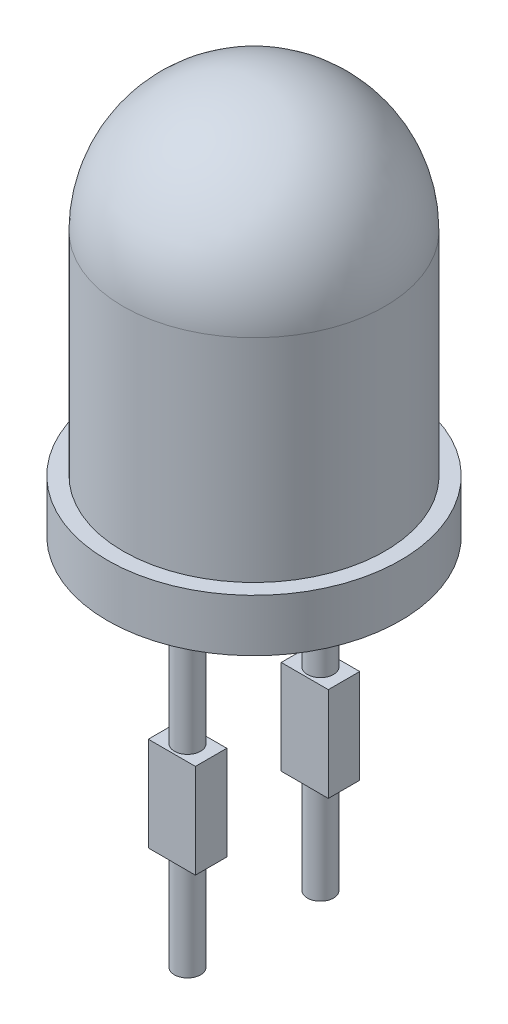
from build123d import *

# Parameters (mm, degrees)
SKETCH2_R               = 0.25
BOSS_EXTRUDE1_DEPTH     = 11
BOSS_EXTRUDE1_2_DEPTH   = 11
SKETCH3_W               = 0.6
SKETCH3_H               = 1.8
BOSS_EXTRUDE2_DEPTH     = 0.45
CUT_EXTRUDE1_DEPTH      = 15.573284633
CUT_EXTRUDE1_DEPTH_BACK = 15.573284633
SKETCH4_W               = 8.036737383
SKETCH4_H               = 5.797333998


with BuildPart() as part:
    # Sketch1 → Revolve1 (revolve)
    with BuildSketch(Plane(origin=(0, 0, 0), x_dir=(0, 0, -1), z_dir=(1, 0, 0))):
        with BuildLine():
            Line((-2.5, 2.025), (-2.5, -2.025))
            Line((-2.5, -2.025), (-2.8, -2.025))
            Line((-2.8, -2.025), (-2.8, -3.025))
            Line((-2.8, -3.025), (0, -3.025))
            Line((0, -3.025), (0, 4.525))
            ThreePointArc((0, 4.525), (-1.767766953, 3.792766953), (-2.5, 2.025))
        make_face()
    revolve(axis=Axis((0, 4.525, 0), (0, -1, 0)))


with BuildPart() as body_2:
    # Sketch2 → Boss-Extrude1 (new body)
    with BuildSketch(Plane.XZ.offset(3.025)):
        with Locations((0, 1.27)):
            Circle(SKETCH2_R)
    extrude(amount=BOSS_EXTRUDE1_DEPTH)



with BuildPart() as body_3:
    # Sketch2 → Boss-Extrude1 2 (new body)
    with BuildSketch(Plane.XZ.offset(3.025)):
        with Locations((0, -1.27)):
            Circle(SKETCH2_R)
    extrude(amount=BOSS_EXTRUDE1_2_DEPTH)


with BuildPart() as body_2_1:
    add(body_2.part)

    add(body_3.part)  # Boss-Extrude2 merges body 3
    # Sketch3 → Boss-Extrude2 (add, symmetric)
    with BuildSketch(Plane(origin=(0, 0, 0), x_dir=(0, 0, -1), z_dir=(1, 0, 0))):
        with Locations((1.27, -6.725)):
            Rectangle(SKETCH3_W, SKETCH3_H)
        with Locations((-1.27, -6.725)):
            Rectangle(SKETCH3_W, SKETCH3_H)
    extrude(amount=BOSS_EXTRUDE2_DEPTH, both=True)

    # Sketch4 → Cut-Extrude1 (cut, two sides: drawn at the far end of the back side and taken through both)
    with BuildSketch(Plane(origin=(0, 0, 0), x_dir=(0, 0, -1), z_dir=(1, 0, 0)).offset(-CUT_EXTRUDE1_DEPTH_BACK)):
        with Locations((0.136038523, -12.423666999)):
            Rectangle(SKETCH4_W, SKETCH4_H)
    extrude(amount=CUT_EXTRUDE1_DEPTH + CUT_EXTRUDE1_DEPTH_BACK, mode=Mode.SUBTRACT)


solid = Compound([part.part, body_2_1.part])
